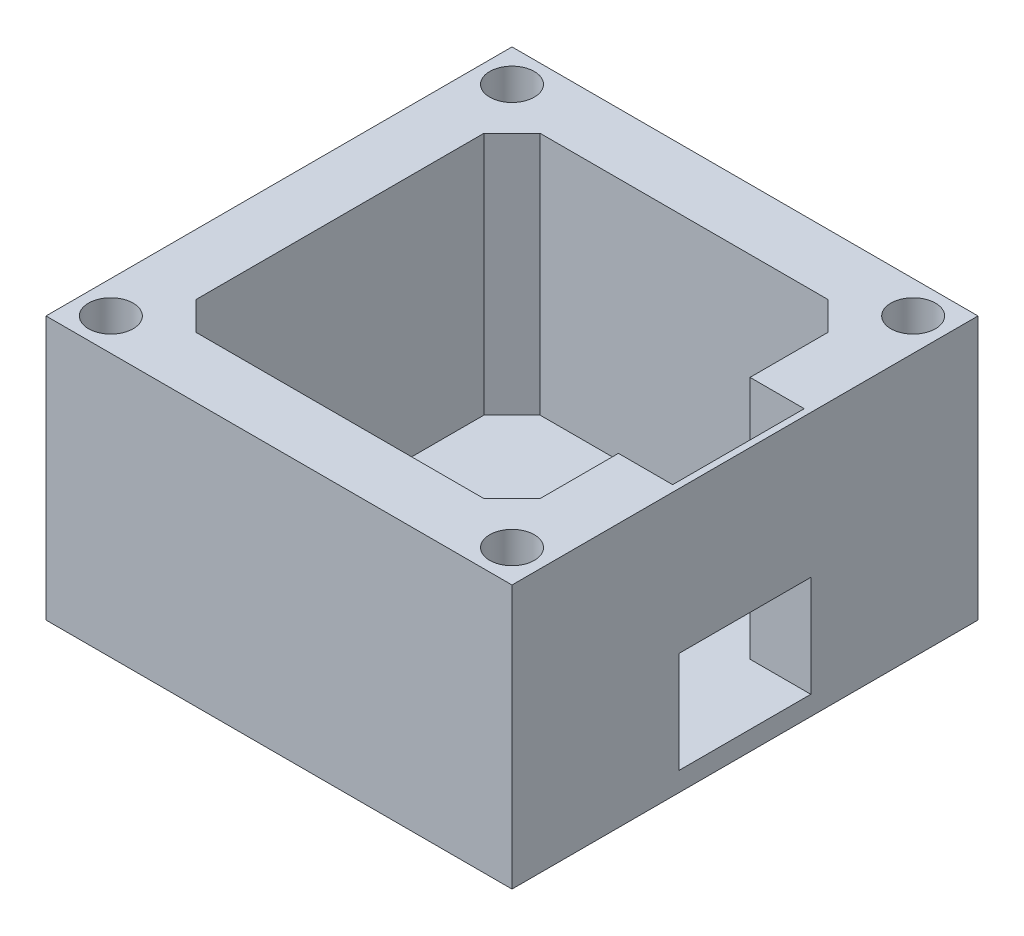
from build123d import *

# Parameters (mm, degrees)
SKETCH1_W           = 58.42
SKETCH1_H           = 58.42
BOSS_EXTRUDE1_DEPTH = 33.02
CUT_EXTRUDE1_DEPTH  = 30.600000014
SKETCH3_W           = 16.5
SKETCH3_H           = 12.7
CUT_EXTRUDE2_DEPTH  = 30.600000014
SKETCH4_R           = 2.794
CUT_EXTRUDE3_DEPTH  = 89.972541832


with BuildPart() as part:
    # Sketch1 → Boss-Extrude1 (new body)
    with BuildSketch(Plane(origin=(0, 0, 0), x_dir=(1, 0, 0), z_dir=(0, 1, 0))):
        with Locations((29.21, 29.21)):
            Rectangle(SKETCH1_W, SKETCH1_H)
    extrude(amount=BOSS_EXTRUDE1_DEPTH)

    # Sketch2 → Cut-Extrude1 (cut)
    with BuildSketch(Plane(origin=(0, 33.02, 0), x_dir=(1, 0, 0), z_dir=(0, 1, 0))):
        Polygon((11.155533906, 50.8), (47.264466094, 50.8), (50.8, 47.264466094), (50.8, 37.46), (57.6, 37.46), (57.6, 20.96), (50.8, 20.96), (50.8, 11.155533906), (47.264466094, 7.62), (11.155533906, 7.62), (7.62, 11.155533906), (7.62, 47.264466094), align=None)
    extrude(amount=-CUT_EXTRUDE1_DEPTH, mode=Mode.SUBTRACT)

    # Sketch3 → Cut-Extrude2 (cut)
    with BuildSketch(Plane(origin=(58.42, 0, 0), x_dir=(0, 0, -1), z_dir=(1, 0, 0))):
        with Locations((29.21, 8.769999986)):
            Rectangle(SKETCH3_W, SKETCH3_H)
    extrude(amount=-CUT_EXTRUDE2_DEPTH, mode=Mode.SUBTRACT)

    # Sketch4 → Cut-Extrude3 (cut, through all)
    with BuildSketch(Plane(origin=(0, 33.02, 0), x_dir=(1, 0, 0), z_dir=(0, 1, 0))):
        with Locations((4.064, 54.356)):
            Circle(SKETCH4_R)
        with Locations((54.356, 54.356)):
            Circle(SKETCH4_R)
        with Locations((54.356, 4.064)):
            Circle(SKETCH4_R)
        with Locations((4.064, 4.064)):
            Circle(SKETCH4_R)
    extrude(amount=-CUT_EXTRUDE3_DEPTH, mode=Mode.SUBTRACT)


solid = part.part
